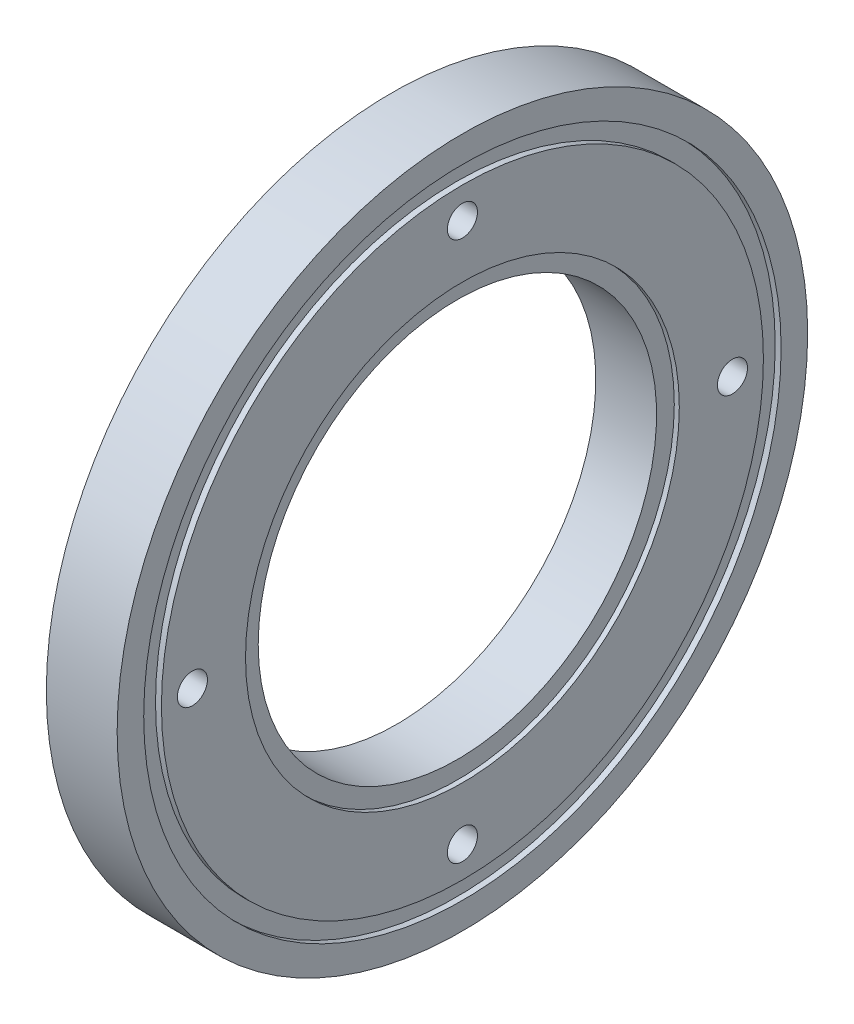
from build123d import *

# Parameters (mm, degrees)
M3_CLEARANCE_HOLE1_D     = 3.4
M3_CLEARANCE_HOLE1_DEPTH = 8
M3_CLEARANCE_HOLE1_TIP   = 1.021463052


with BuildPart() as part:
    # Sketch1 → Revolve17 (revolve)
    with BuildSketch(Plane.XY):
        Polygon((20.481671209, 24.5), (21.047671209, 24.5), (21.047671209, 34), (20.380671209, 34), (20.380671209, 36), (21.047671209, 36), (21.047671209, 39), (13.047671209, 39), (13.047671209, 36), (13.714671209, 36), (13.714671209, 34), (13.047671209, 34), (13.047671209, 24.5), (13.613671209, 24.5), (13.613671209, 22.5), (18.481671209, 22.5), (20.481671209, 22.5), align=None)
    revolve(axis=Axis((-801.920554309, 0, 0), (1, 0, 0)))

    # M3 Clearance Hole1
    with Locations(Plane.ZY.offset(-13.047671209)):
        with Locations((0, -30.5), (0, 30.5), (30.5, 0), (-30.5, 0)):
            Hole(M3_CLEARANCE_HOLE1_D / 2, depth=M3_CLEARANCE_HOLE1_DEPTH)
            with Locations((0, 0, -(M3_CLEARANCE_HOLE1_DEPTH + M3_CLEARANCE_HOLE1_TIP / 2))):  # 118° drill point
                Cone(0, M3_CLEARANCE_HOLE1_D / 2, M3_CLEARANCE_HOLE1_TIP, mode=Mode.SUBTRACT)


solid = part.part
